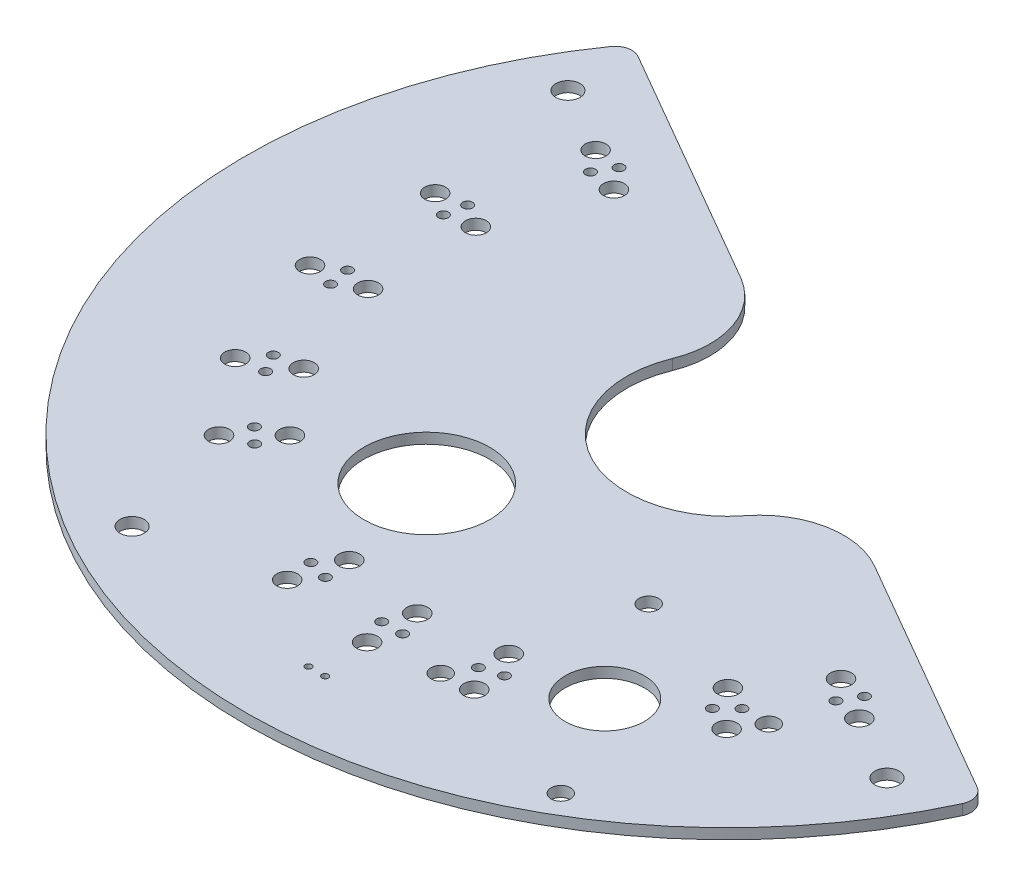
from build123d import *

# Parameters (mm, degrees)
SKETCH1_R           = 73.025
SKETCH1_R_2         = 15.24
SKETCH1_R_3         = 0.75
SKETCH1_R_4         = 1.585
SKETCH1_R_5         = 20
SKETCH1_R_6         = 9.525
SKETCH1_R_7         = 6
BOSS_EXTRUDE1_DEPTH = 1.5875
SKETCH2_R           = 1.8288
CUT_EXTRUDE1_DEPTH  = 104.285146107
CUT_EXTRUDE2_DEPTH  = 104.285146107
FILLET1_R           = 12.7
FILLET2_R           = 2.54
SKETCH4_R           = 0.4953
CUT_EXTRUDE3_DEPTH  = 104.285146107
SKETCH5_R           = 0.4953
SKETCH5_R_2         = 0.75
SKETCH5_R_3         = 0.750000002
SKETCH5_R_4         = 0.750000001
BOSS_EXTRUDE2_DEPTH = 0.1016
SKETCH6_R           = 1.4732
CUT_EXTRUDE4_DEPTH  = 104.285146107


with BuildPart() as part:
    # Sketch1 → Boss-Extrude1 (new body)
    with BuildSketch(Plane(origin=(0, 0, 0), x_dir=(1, 0, 0), z_dir=(0, 1, 0))):
        Circle(SKETCH1_R)
        Circle(SKETCH1_R_2, mode=Mode.SUBTRACT)
        with Locations((-1.585, 50.8)):
            Circle(SKETCH1_R_3, mode=Mode.SUBTRACT)
        with Locations((1.585, 50.8)):
            Circle(SKETCH1_R_3, mode=Mode.SUBTRACT)
        with Locations((0, 54.6)):
            Circle(SKETCH1_R_4, mode=Mode.SUBTRACT)
        with Locations((0, 47)):
            Circle(SKETCH1_R_4, mode=Mode.SUBTRACT)
        with Locations((47.284987047, 27.3)):
            Circle(SKETCH1_R_4, mode=Mode.SUBTRACT)
        with Locations((43.201590512, 26.772650265)):
            Circle(SKETCH1_R_3, mode=Mode.SUBTRACT)
        with Locations((44.786590512, 24.027349735)):
            Circle(SKETCH1_R_3, mode=Mode.SUBTRACT)
        with Locations((40.703193978, 23.5)):
            Circle(SKETCH1_R_4, mode=Mode.SUBTRACT)
        with Locations((47.284987047, -27.3)):
            Circle(SKETCH1_R_4, mode=Mode.SUBTRACT)
        with Locations((44.786590512, -24.027349735)):
            Circle(SKETCH1_R_3, mode=Mode.SUBTRACT)
        with Locations((43.201590512, -26.772650265)):
            Circle(SKETCH1_R_3, mode=Mode.SUBTRACT)
        with Locations((40.703193978, -23.5)):
            Circle(SKETCH1_R_4, mode=Mode.SUBTRACT)
        with Locations((0, -54.6)):
            Circle(SKETCH1_R_4, mode=Mode.SUBTRACT)
        with Locations((1.585, -50.8)):
            Circle(SKETCH1_R_3, mode=Mode.SUBTRACT)
        with Locations((-1.585, -50.8)):
            Circle(SKETCH1_R_3, mode=Mode.SUBTRACT)
        with Locations((0, -47)):
            Circle(SKETCH1_R_4, mode=Mode.SUBTRACT)
        with Locations((-47.284987047, -27.3)):
            Circle(SKETCH1_R_4, mode=Mode.SUBTRACT)
        with Locations((-43.201590512, -26.772650265)):
            Circle(SKETCH1_R_3, mode=Mode.SUBTRACT)
        with Locations((-44.786590512, -24.027349735)):
            Circle(SKETCH1_R_3, mode=Mode.SUBTRACT)
        with Locations((-40.703193978, -23.5)):
            Circle(SKETCH1_R_4, mode=Mode.SUBTRACT)
        with Locations((-47.284987047, 27.3)):
            Circle(SKETCH1_R_4, mode=Mode.SUBTRACT)
        with Locations((-44.786590512, 24.027349735)):
            Circle(SKETCH1_R_3, mode=Mode.SUBTRACT)
        with Locations((-43.201590512, 26.772650265)):
            Circle(SKETCH1_R_3, mode=Mode.SUBTRACT)
        with Locations((-40.703193978, 23.5)):
            Circle(SKETCH1_R_4, mode=Mode.SUBTRACT)
        with Locations((25.4, 43.994090512)):
            Circle(SKETCH1_R_5, mode=Mode.SUBTRACT)
        with Locations((-16.320688268, -29.242892178)):
            Circle(SKETCH1_R_6, mode=Mode.SUBTRACT)
        with Locations((25.4, -43.994090512)):
            Circle(SKETCH1_R_7, mode=Mode.SUBTRACT)
        with Locations((-46.285964392, 8.16146435)):
            Circle(SKETCH1_R_4, mode=Mode.SUBTRACT)
        with Locations((-50.303466215, 7.260407137)):
            Circle(SKETCH1_R_3, mode=Mode.SUBTRACT)
        with Locations((-49.753001491, 10.382247714)):
            Circle(SKETCH1_R_3, mode=Mode.SUBTRACT)
        with Locations((-53.770503314, 9.481190501)):
            Circle(SKETCH1_R_4, mode=Mode.SUBTRACT)
        with Locations((-46.285964392, -8.16146435)):
            Circle(SKETCH1_R_4, mode=Mode.SUBTRACT)
        with Locations((-49.753001491, -10.382247714)):
            Circle(SKETCH1_R_3, mode=Mode.SUBTRACT)
        with Locations((-50.303466215, -7.260407137)):
            Circle(SKETCH1_R_3, mode=Mode.SUBTRACT)
        with Locations((-53.770503314, -9.481190501)):
            Circle(SKETCH1_R_4, mode=Mode.SUBTRACT)
        with Locations((-34.540268185, -37.101507151)):
            Circle(SKETCH1_R_3, mode=Mode.SUBTRACT)
        with Locations((-36.799076534, -34.871722247)):
            Circle(SKETCH1_R_3, mode=Mode.SUBTRACT)
        with Locations((-38.370984134, -38.66907198)):
            Circle(SKETCH1_R_4, mode=Mode.SUBTRACT)
        with Locations((-32.986863365, -33.305169676)):
            Circle(SKETCH1_R_4, mode=Mode.SUBTRACT)
        with Locations((-14.730224252, -48.388224257)):
            Circle(SKETCH1_R_3, mode=Mode.SUBTRACT)
        with Locations((-11.673604783, -49.243346058)):
            Circle(SKETCH1_R_3, mode=Mode.SUBTRACT)
        with Locations((-12.1397751, -45.16003322)):
            Circle(SKETCH1_R_4, mode=Mode.SUBTRACT)
        with Locations((-14.248361791, -52.461681428)):
            Circle(SKETCH1_R_4, mode=Mode.SUBTRACT)
        with Locations((34.838579463, -37.125134571)):
            Circle(SKETCH1_R_3, mode=Mode.SUBTRACT)
        with Locations((37.107446401, -34.905585361)):
            Circle(SKETCH1_R_3, mode=Mode.SUBTRACT)
        with Locations((33.338108593, -33.267644279)):
            Circle(SKETCH1_R_4, mode=Mode.SUBTRACT)
        with Locations((38.607228085, -38.744558024)):
            Circle(SKETCH1_R_4, mode=Mode.SUBTRACT)
        with Locations((11.756179422, -49.493467435)):
            Circle(SKETCH1_R_3, mode=Mode.SUBTRACT)
        with Locations((14.801485259, -48.59889031)):
            Circle(SKETCH1_R_3, mode=Mode.SUBTRACT)
        with Locations((12.242324274, -45.383077263)):
            Circle(SKETCH1_R_4, mode=Mode.SUBTRACT)
        with Locations((14.323425392, -52.692606833)):
            Circle(SKETCH1_R_4, mode=Mode.SUBTRACT)
    extrude(amount=-BOSS_EXTRUDE1_DEPTH)

    # Sketch2 → Cut-Extrude1 (cut, through all)
    with BuildSketch(Plane(origin=(0, 0, 0), x_dir=(1, 0, 0), z_dir=(0, 1, 0))):
        with Locations((-57.192317666, 33.02)):
            Circle(SKETCH2_R)
        with Locations((33.02, 57.192317666)):
            Circle(SKETCH2_R)
        with Locations((57.192317666, -33.02)):
            Circle(SKETCH2_R)
        with Locations((-33.02, -57.192317666)):
            Circle(SKETCH2_R)
    extrude(amount=-CUT_EXTRUDE1_DEPTH, mode=Mode.SUBTRACT)

    # Sketch3 → Cut-Extrude2 (cut, through all)
    with BuildSketch(Plane(origin=(0, 0, 0), x_dir=(1, 0, 0), z_dir=(0, 1, 0))):
        with BuildLine():
            Line((-59.533825484, 44.637157955), (68.423825484, -29.239226276))
            ThreePointArc((68.423825484, -29.239226276), (37.204677955, 64.440392498), (-59.533825484, 44.637157955))
        make_face()
    extrude(amount=-CUT_EXTRUDE2_DEPTH, mode=Mode.SUBTRACT)

    # Fillet1
    fillet1_edges = [part.edges().sort_by_distance(p)[0] for p in [
        (15.165033815, -0.79375, -1.509751431),
        (-6.275033815, -0.79375, -13.888180249),
    ]]
    fillet(fillet1_edges, radius=FILLET1_R)

    # Fillet2
    fillet2_edges = [part.edges().sort_by_distance(p)[0] for p in [
        (67.216123088, -0.79375, 28.541958973),
        (-58.326123088, -0.79375, -43.939890652),
    ]]
    fillet(fillet2_edges, radius=FILLET2_R)

    # Sketch4 → Cut-Extrude3 (cut, through all)
    with BuildSketch(Plane(origin=(0, 0, 0), x_dir=(1, 0, 0), z_dir=(0, 1, 0))):
        with Locations((1.27, -62.23)):
            Circle(SKETCH4_R)
        with Locations((-1.27, -62.23)):
            Circle(SKETCH4_R)
    extrude(amount=-CUT_EXTRUDE3_DEPTH, mode=Mode.SUBTRACT)

    # Sketch5 → Boss-Extrude2 (add)
    # profile 1 of 7: a face of its own
    with BuildSketch(Plane.XZ.offset(1.5875)):
        with BuildLine():
            Line((33.431303181, 14.660751587), (45.194329231, 21.436940675))
            ThreePointArc((45.194329231, 21.436940675), (44.862283466, 22.11383287), (44.520054164, 22.785633836))
            ThreePointArc((44.520054164, 22.785633836), (43.928461495, 24.963573314), (46.046767935, 24.184997639))
            ThreePointArc((46.046767935, 24.184997639), (46.506663794, 23.288391333), (46.949103322, 22.383043703))
            Line((46.949103322, 22.383043703), (54.818396386, 26.956712917))
            ThreePointArc((54.818396386, 26.956712917), (41.641357064, 44.695842485), (23.015374367, 56.586336658))
            Line((23.015374367, 56.586336658), (18.501902753, 46.647707327))
            Line((18.501902753, 46.647707327), (15.357853932, 47.480513589))
            ThreePointArc((15.357853932, 47.480513589), (13.516366821, 48.7569079), (15.601429277, 49.57713456))
            Line((15.601429277, 49.57713456), (17.346772954, 49.127897114))
            Line((17.346772954, 49.127897114), (20.954476142, 57.38145069))
            ThreePointArc((20.954476142, 57.38145069), (11.253035965, 60.04240281), (1.246430533, 61.075096108))
            ThreePointArc((1.246430533, 61.075096108), (0.115096108, 62.253569467), (1.293569467, 63.384903892))
            ThreePointArc((1.293569467, 63.384903892), (34.847178248, 52.962189641), (57.697964415, 26.272880805))
            Line((57.697964415, 26.272880805), (28.012465947, 9.133950273))
            ThreePointArc((28.012465947, 9.133950273), (-9.966341124, 17.366115575), (-22.30608396, -19.483430947))
            Line((-22.30608396, -19.483430947), (-29.83516689, -23.556613805))
            Line((-29.83516689, -23.556613805), (-36.397117592, -27.130853686))
            Line((-36.397117592, -27.130853686), (-39.459709044, -21.521462671))
            ThreePointArc((-39.459709044, -21.521462671), (-43.38379222, -11.090113616), (-44.273580184, 0.01933053))
            Line((-44.273580184, 0.01933053), (-49.722075899, -0.050812165))
            ThreePointArc((-49.722075899, -0.050812165), (-49.629681507, -3.252770165), (-49.332148348, -6.442213028))
            ThreePointArc((-49.332148348, -6.442213028), (-50.004405827, -8.494693523), (-51.541564399, -6.977541644))
            ThreePointArc((-51.541564399, -6.977541644), (-52.011719334, -1e-09), (-51.541564399, 6.977541642))
            ThreePointArc((-51.541564399, 6.977541642), (-50.058061, 8.506471453), (-49.265083467, 6.529201785))
            ThreePointArc((-49.265083467, 6.529201785), (-49.492801485, 4.569553759), (-49.642923061, 2.602439273))
            Line((-49.642923061, 2.602439273), (-41.994222134, 2.662628969))
            ThreePointArc((-41.994222134, 2.662628969), (-40.82055302, -9.52771799), (-36.367023368, -20.935966401))
            Line((-36.367023368, -20.935966401), (-34.936628557, -23.491462217))
            Line((-34.936628557, -23.491462217), (-30.061424416, -20.827052323))
            Line((-30.061424416, -20.827052323), (-25.398334074, -18.114316974))
            ThreePointArc((-25.398334074, -18.114316974), (-22.210007728, 9.151758335), (1.113762733, 23.629535069))
            Line((1.113762733, 23.629535069), (-10.73428306, 48.403612097))
            ThreePointArc((-10.73428306, 48.403612097), (-12.910878194, 48.935298882), (-11.258247644, 50.448265995))
            Line((-11.258247644, 50.448265995), (-9.711165844, 50.849280581))
            Line((-9.711165844, 50.849280581), (3.449883172, 23.791032751))
            ThreePointArc((3.449883172, 23.791032751), (17.595723773, 20.946572186), (29.001504046, 12.108928915))
            Line((29.001504046, 12.108928915), (33.431303181, 14.660751587))
        make_face()
        with Locations((1.27, 62.23)):
            Circle(SKETCH5_R, mode=Mode.SUBTRACT)
        with Locations((44.786590512, 24.027349735)):
            Circle(SKETCH5_R_2, mode=Mode.SUBTRACT)
        with Locations((-50.303466216, 7.260407137)):
            Circle(SKETCH5_R_3, mode=Mode.SUBTRACT)
        with Locations((-50.303466216, -7.260407137)):
            Circle(SKETCH5_R_4, mode=Mode.SUBTRACT)
        with Locations((-11.680630851, 49.250563015)):
            Circle(SKETCH5_R_2, mode=Mode.SUBTRACT)
        with Locations((14.777882222, 48.610351106)):
            Circle(SKETCH5_R_2, mode=Mode.SUBTRACT)
    # profile 2 of 7: a face of its own
    with BuildSketch(Plane.XZ.offset(1.5875)):
        with BuildLine():
            Line((-40.179600837, 32.308280263), (-48.041009065, 37.733041246))
            ThreePointArc((-48.041009065, 37.733041246), (-30.422874238, 52.973292108), (-8.380669008, 60.510208565))
            Line((-8.380669008, 60.510208565), (-6.173483064, 49.305754528))
            ThreePointArc((-6.173483064, 49.305754528), (-4.922043167, 44.555542978), (-2.538833519, 40.260089176))
            ThreePointArc((-2.538833519, 40.260089176), (12.76962162, 38.265614065), (26.207921345, 30.667006943))
            Line((26.207921345, 30.667006943), (30.250126821, 34.116035809))
            Line((30.250126821, 34.116035809), (33.580991214, 36.958109897))
            ThreePointArc((33.580991214, 36.958109897), (35.732888619, 36.207518127), (35.014567522, 38.370401676))
            Line((35.014567522, 38.370401676), (33.308700111, 39.633851204))
            Line((33.308700111, 39.633851204), (26.280466259, 33.565797389))
            ThreePointArc((26.280466259, 33.565797389), (13.250949758, 40.518366103), (-1.368880737, 42.608119257))
            ThreePointArc((-1.368880737, 42.608119257), (-3.160600525, 45.985861005), (-3.65720678, 49.777006127))
            Line((-3.65720678, 49.777006127), (-2.49856231, 49.917784661))
            ThreePointArc((-2.49856231, 49.917784661), (-0.340785212, 50.545383503), (-2.078561622, 51.970169614))
            ThreePointArc((-2.078561622, 51.970169614), (-3.115634234, 51.918318264), (-4.151465061, 51.845774041))
            Line((-4.151465061, 51.845774041), (-5.602971999, 60.830318579))
            ThreePointArc((-5.602971999, 60.830318579), (-3.515533485, 60.986572112), (-1.423967004, 61.071214755))
            ThreePointArc((-1.423967004, 61.071214755), (-0.111437666, 62.074364523), (-1.112696373, 63.38833702))
            ThreePointArc((-1.112696373, 63.38833702), (-55.045320867, 31.453648661), (-55.175696114, -31.224380246))
            ThreePointArc((-55.175696114, -31.224380246), (-47.251425728, -33.169819962), (-41.946969776, -26.969695456))
            ThreePointArc((-41.946969776, -26.969695456), (-43.676761737, -25.594892944), (-43.968206313, -27.785171975))
            ThreePointArc((-43.968206313, -27.785171975), (-49.046573827, -31.131186481), (-54.277718664, -28.02945255))
            ThreePointArc((-54.277718664, -28.02945255), (-60.892129227, 4.885647531), (-49.114269167, 36.325053583))
            Line((-49.114269167, 36.325053583), (-41.669894568, 31.126176039))
            ThreePointArc((-41.669894568, 31.126176039), (-42.851623746, 29.478081525), (-43.968206313, 27.785171975))
            ThreePointArc((-43.968206313, 27.785171975), (-43.872154183, 25.694112197), (-41.954385231, 26.533111156))
            ThreePointArc((-41.954385231, 26.533111156), (-40.498180545, 28.701039095), (-38.930606871, 30.789856084))
            Line((-38.930606871, 30.789856084), (-36.363255307, 33.67976915))
            ThreePointArc((-36.363255307, 33.67976915), (-36.031061204, 35.895599535), (-38.057194658, 34.939022072))
            Line((-38.057194658, 34.939022072), (-40.179600837, 32.308280263))
        make_face()
        with Locations((-1.27, 62.23)):
            Circle(SKETCH5_R, mode=Mode.SUBTRACT)
        with Locations((-1.585, 50.8)):
            Circle(SKETCH5_R_2, mode=Mode.SUBTRACT)
        with Locations((-43.201590512, 26.772650265)):
            Circle(SKETCH5_R_2, mode=Mode.SUBTRACT)
        with Locations((-43.201590512, -26.772650265)):
            Circle(SKETCH5_R_2, mode=Mode.SUBTRACT)
        with Locations((-36.788740811, 34.876373548)):
            Circle(SKETCH5_R_2, mode=Mode.SUBTRACT)
        with Locations((34.841604357, 37.112234858)):
            Circle(SKETCH5_R_2, mode=Mode.SUBTRACT)
    # profile 3 of 7: a face of its own
    with BuildSketch(Plane.XZ.offset(1.5875)):
        with BuildLine():
            Line((-15.668470753, 49.243568824), (-34.880459972, 38.3226642))
            ThreePointArc((-34.880459972, 38.3226642), (-35.366413381, 36.135404156), (-33.278488016, 36.948315519))
            Line((-33.278488016, 36.948315519), (-15.144506169, 47.198914926))
            ThreePointArc((-15.144506169, 47.198914926), (-13.491875619, 48.711882038), (-15.668470753, 49.243568824))
        make_face()
        with Locations((-34.539481833, 37.099294302)):
            Circle(SKETCH5_R_2, mode=Mode.SUBTRACT)
        with Locations((-14.722122963, 48.396617906)):
            Circle(SKETCH5_R_2, mode=Mode.SUBTRACT)
    # profile 4 of 7: a face of its own
    with BuildSketch(Plane.XZ.offset(1.5875)):
        with BuildLine():
            ThreePointArc((11.474051524, 50.730317264), (6.804604267, 51.564680828), (2.078561622, 51.970169614))
            ThreePointArc((2.078561622, 51.970169614), (0.316211231, 50.744546781), (2.178770631, 49.677352933))
            ThreePointArc((2.178770631, 49.677352933), (6.555517579, 49.310867596), (10.883123439, 48.561165739))
            ThreePointArc((10.883123439, 48.561165739), (12.974163873, 49.156584102), (11.474051524, 50.730317264))
        make_face()
        with Locations((1.585, 50.8)):
            Circle(SKETCH5_R_2, mode=Mode.SUBTRACT)
        with Locations((11.748819415, 49.490396861)):
            Circle(SKETCH5_R_2, mode=Mode.SUBTRACT)
    # profile 5 of 7: a face of its own
    with BuildSketch(Plane.XZ.offset(1.5875)):
        with BuildLine():
            ThreePointArc((-48.57465514, -10.855956351), (-49.874379936, -9.118061307), (-50.819687523, -11.071508849))
            ThreePointArc((-50.819687523, -11.071508849), (-48.875028852, -17.789055702), (-46.046767936, -24.184997638))
            ThreePointArc((-46.046767936, -24.184997638), (-44.02071561, -25.040431979), (-44.291317384, -22.857903487))
            ThreePointArc((-44.291317384, -22.857903487), (-46.817478234, -16.994150069), (-48.57465514, -10.855956351))
        make_face()
        with Locations((-49.753001492, -10.382247714)):
            Circle(SKETCH5_R_4, mode=Mode.SUBTRACT)
        with Locations((-44.786590512, -24.027349735)):
            Circle(SKETCH5_R_2, mode=Mode.SUBTRACT)
    # profile 6 of 7: a face of its own
    with BuildSketch(Plane.XZ.offset(1.5875)):
        with BuildLine():
            ThreePointArc((41.981918042, 27.126626343), (43.601259968, 25.567177608), (43.968206314, 27.785171975))
            ThreePointArc((43.968206314, 27.785171975), (41.320524841, 31.58849751), (38.344818524, 35.141056337))
            ThreePointArc((38.344818524, 35.141056337), (36.217919968, 35.887831633), (36.830514784, 33.718477259))
            ThreePointArc((36.830514784, 33.718477259), (39.544528317, 30.530639864), (41.981918042, 27.126626343))
        make_face()
        with Locations((43.201590512, 26.772650265)):
            Circle(SKETCH5_R_2, mode=Mode.SUBTRACT)
        with Locations((37.087474469, 34.962210237)):
            Circle(SKETCH5_R_2, mode=Mode.SUBTRACT)
    # profile 7 of 7: a face of its own
    with BuildSketch(Plane.XZ.offset(1.5875)):
        with BuildLine():
            ThreePointArc((-50.819687522, 11.071508851), (-49.964616374, 9.130002075), (-48.519060432, 10.682729755))
            ThreePointArc((-48.519060432, 10.682729755), (-46.654174604, 17.019981838), (-43.968959144, 23.055558119))
            ThreePointArc((-43.968959144, 23.055558119), (-44.180067504, 25.143158787), (-46.046767936, 24.184997639))
            ThreePointArc((-46.046767936, 24.184997639), (-46.953495579, 22.373828483), (-47.789017827, 20.528729217))
            ThreePointArc((-47.789017827, 20.528729217), (-49.530585974, 15.872617969), (-50.819687522, 11.071508851))
        make_face()
        with Locations((-44.786590512, 24.027349735)):
            Circle(SKETCH5_R_2, mode=Mode.SUBTRACT)
        with Locations((-49.753001493, 10.382247714)):
            Circle(SKETCH5_R_3, mode=Mode.SUBTRACT)
    extrude(amount=BOSS_EXTRUDE2_DEPTH)

    # Sketch6 → Cut-Extrude4 (cut, through all)
    with BuildSketch(Plane.XZ.offset(1.5875)):
        with Locations((34.496852839, 59.750301818)):
            Circle(SKETCH6_R)
        with Locations((9.643788694, 53.090943351)):
            Circle(SKETCH6_R)
        with Locations((16.303147161, 28.237879206)):
            Circle(SKETCH6_R)
        with Locations((41.156211306, 34.897237673)):
            Circle(SKETCH6_R)
    extrude(amount=-CUT_EXTRUDE4_DEPTH, mode=Mode.SUBTRACT)


solid = part.part
